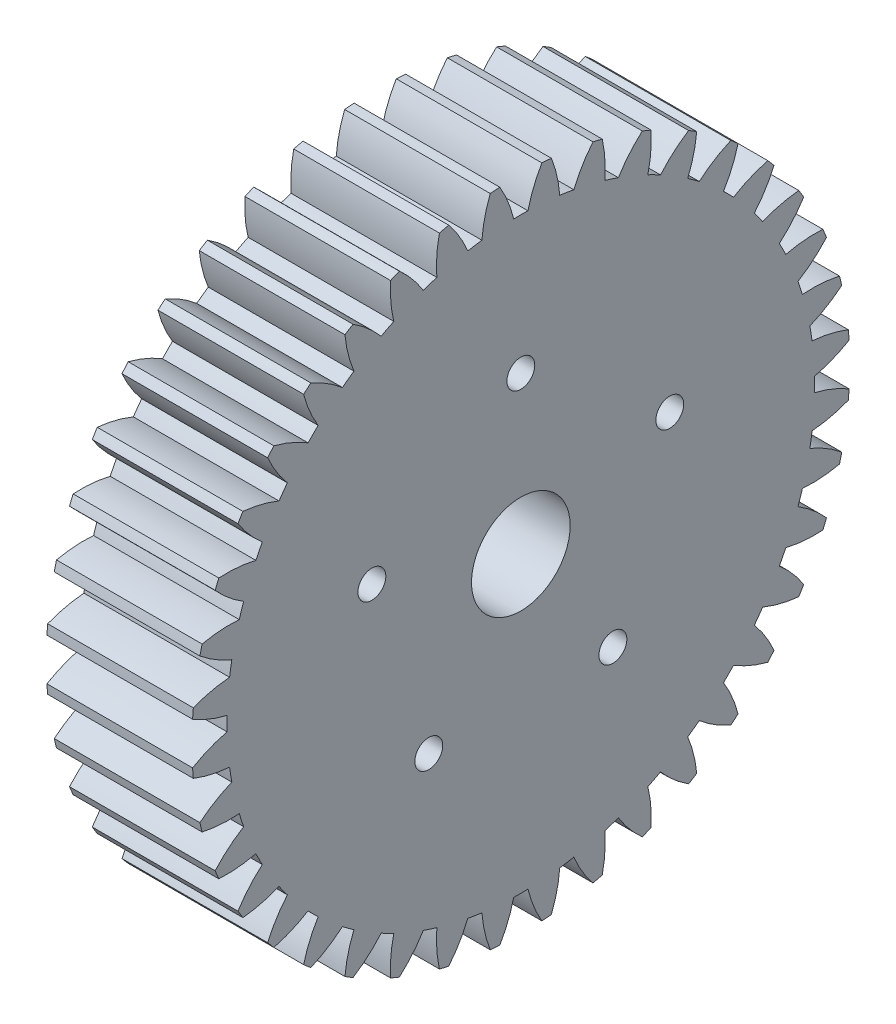
from build123d import *

# Parameters (mm, degrees)
BASPROSKE_W        = 11.811
BASPROSKE_H        = 26.67
TOOTHCUT_DEPTH     = 40.523126407
TEETHCUTS_COUNT    = 40
TEETHCUTS_ANGLE    = 351
BORSKE_R           = 0.396875
BORE_DEPTH         = 50.8000508
SKETCH3_R          = 4
SKETCH3_R_2        = 1.1303
CUT_EXTRUDE1_DEPTH = 15.748


with BuildPart() as part:
    # BasProSke → Base-Revolve (revolve)
    with BuildSketch(Plane(origin=(0, 0, 0), x_dir=(1, 0, 0), z_dir=(0, 1, 0))):
        with Locations((5.9055, 13.335)):
            Rectangle(BASPROSKE_W, BASPROSKE_H)
    revolve(axis=Axis((-10, 0, 0), (1, 0, 0)))

    # TooCutSke → ToothCut (cut, through all)
    with BuildSketch(Plane(origin=(0, 0, 0), x_dir=(0, 0, -1), z_dir=(1, 0, 0))):
        with BuildLine():
            ThreePointArc((0.577296327, 23.818204886), (0, 23.8252), (-0.577296327, 23.818204886))
            ThreePointArc((-0.577296327, 23.818204886), (-1.042980967, 25.272123589), (-1.721261603, 26.639850594))
            ThreePointArc((-1.721261603, 26.639850594), (0, 26.6954), (1.721261603, 26.639850594))
            ThreePointArc((1.721261603, 26.639850594), (1.042980967, 25.272123589), (0.577296327, 23.818204886))
        make_face()
    toothcut = extrude(amount=TOOTHCUT_DEPTH, mode=Mode.SUBTRACT)

    # TeethCuts: ToothCut ×40 about axis
    teethcuts_axis = Axis((-10, 0, 0), (1, 0, 0))
    for i in range(1, TEETHCUTS_COUNT):
        add(toothcut.rotate(teethcuts_axis, i * TEETHCUTS_ANGLE / (TEETHCUTS_COUNT - 1)), mode=Mode.SUBTRACT)

    # BorSke → Bore (cut, symmetric)
    with BuildSketch(Plane(origin=(0, 0, 0), x_dir=(0, 0, -1), z_dir=(1, 0, 0))):
        Circle(BORSKE_R)
    extrude(amount=BORE_DEPTH, both=True, mode=Mode.SUBTRACT)

    # Sketch3 → Cut-Extrude1 (cut)
    with BuildSketch(Plane(origin=(11.811, 0, 0), x_dir=(0, 0, -1), z_dir=(1, 0, 0))):
        Circle(SKETCH3_R)
        with Locations((0, 12.7)):
            Circle(SKETCH3_R_2)
        with Locations((12.078417757, 3.924515829)):
            Circle(SKETCH3_R_2)
        with Locations((7.464872704, -10.274515829)):
            Circle(SKETCH3_R_2)
        with Locations((-7.464872704, -10.274515829)):
            Circle(SKETCH3_R_2)
        with Locations((-12.078417757, 3.924515829)):
            Circle(SKETCH3_R_2)
    extrude(amount=-CUT_EXTRUDE1_DEPTH, mode=Mode.SUBTRACT)


solid = part.part
